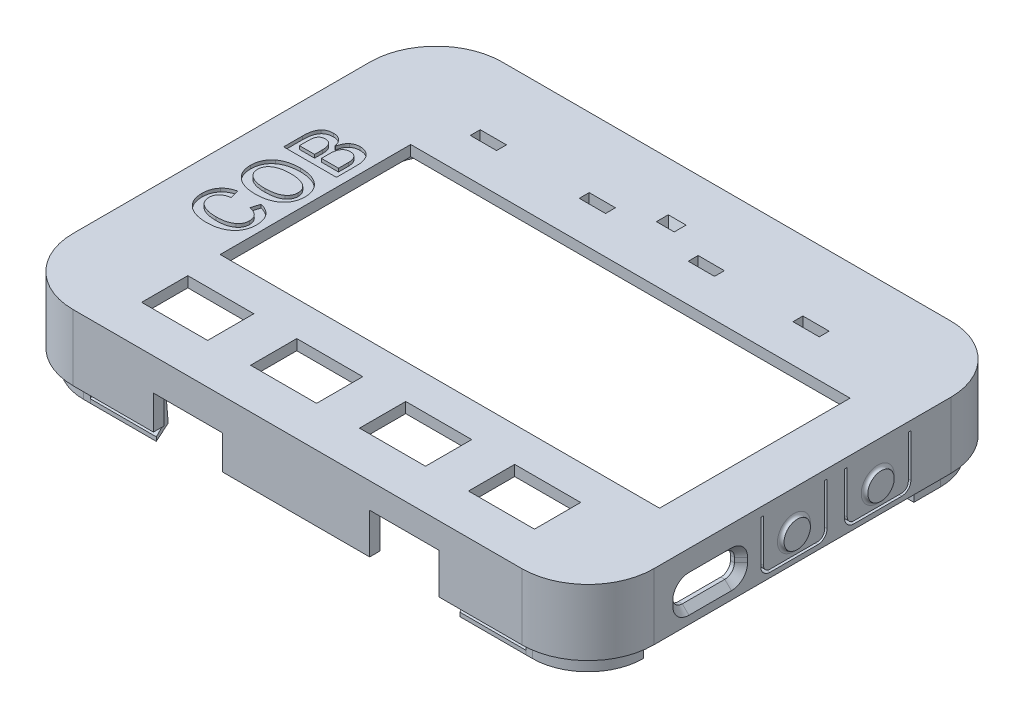
from build123d import *

# Parameters (mm, degrees)
SKETCH1_W              = 88
SKETCH1_H              = 65
BOSS_EXTRUDE1_DEPTH    = 10
FILLET1_R              = 10
SKETCH2_W              = 66.581907709
SKETCH2_H              = 28.876284293
CUT_EXTRUDE1_DEPTH     = 110.859000542
SKETCH4_W              = 10
SKETCH4_H              = 7
CUT_EXTRUDE2_DEPTH     = 110.859000542
CUT_EXTRUDE3_DEPTH     = 8.4
SKETCH11_W             = 10.5
SKETCH11_H             = 5.13
SKETCH11_H_2           = 6.13
CUT_EXTRUDE6_DEPTH     = 5
SKETCH12_W             = 2.7
SKETCH12_H             = 1.8
CUT_EXTRUDE7_DEPTH     = 1.6
CUT_EXTRUDE7_DRAFT     = -20
CUT_EXTRUDE9_DEPTH     = 0.5
SKETCH15_W             = 3.98
SKETCH15_H             = 1.5
CUT_EXTRUDE10_DEPTH    = 110.724928939
SKETCH16_W             = 4.95
SKETCH16_H             = 3.5
SKETCH16_W_2           = 2.95
SKETCH16_H_2           = 1.5
BOSS_EXTRUDE2_DEPTH    = 2.3
CUT_EXTRUDE11_DEPTH    = 10
FILLET2_R              = 0.5
SKETCH19_R             = 2
BOSS_EXTRUDE3_DEPTH    = 0.5
FILLET3_R              = 0.5
CUT_EXTRUDE12_DEPTH    = 5
CHAMFER1_SIZE          = 1
BOSS_EXTRUDE4_START    = 11
BOSS_EXTRUDE4_DEPTH    = 11
BOSS_EXTRUDE10_DEPTH   = 10
BOSS_EXTRUDE10_2_DEPTH = 10
BOSS_EXTRUDE13_DEPTH   = 10
BOSS_EXTRUDE13_2_DEPTH = 10


with BuildPart() as part:
    # Sketch1 → Boss-Extrude1 (new body)
    with BuildSketch(Plane(origin=(0, 0, 0), x_dir=(1, 0, 0), z_dir=(0, 1, 0))):
        with Locations((44, 32.5)):
            Rectangle(SKETCH1_W, SKETCH1_H)
    extrude(amount=BOSS_EXTRUDE1_DEPTH)

    # Fillet1
    fillet1_edges = [part.edges().sort_by_distance(p)[0] for p in [
        (0, 5, -65),
        (88, 5, -65),
        (88, 5, 0),
        (0, 5, 0),
    ]]
    fillet(fillet1_edges, radius=FILLET1_R)

    # Sketch2 → Cut-Extrude1 (cut, through all)
    with BuildSketch(Plane(origin=(0, 10, 0), x_dir=(1, 0, 0), z_dir=(0, 1, 0))):
        with Locations((47.199609362, 32.804029095)):
            Rectangle(SKETCH2_W, SKETCH2_H)
    extrude(amount=-CUT_EXTRUDE1_DEPTH, mode=Mode.SUBTRACT)

    # Sketch4 → Cut-Extrude2 (cut, through all)
    with BuildSketch(Plane(origin=(0, 10, 0), x_dir=(1, 0, 0), z_dir=(0, 1, 0))):
        with Locations((19.235, 9.64)):
            Rectangle(SKETCH4_W, SKETCH4_H)
        with Locations((35.745, 9.64)):
            Rectangle(SKETCH4_W, SKETCH4_H)
        with Locations((52.255, 9.64)):
            Rectangle(SKETCH4_W, SKETCH4_H)
        with Locations((68.765, 9.64)):
            Rectangle(SKETCH4_W, SKETCH4_H)
    extrude(amount=-CUT_EXTRUDE2_DEPTH, mode=Mode.SUBTRACT)

    # Sketch7 → Cut-Extrude3 (cut)
    with BuildSketch(Plane(origin=(0, 0, 0), x_dir=(1, 0, 0), z_dir=(0, 1, 0))):
        with BuildLine():
            Line((86.4, 10), (86.4, 55))
            ThreePointArc((86.4, 55), (83.939696962, 60.939696962), (78, 63.4))
            Line((78, 63.4), (10, 63.4))
            ThreePointArc((10, 63.4), (4.060303038, 60.939696962), (1.6, 55))
            Line((1.6, 55), (1.6, 10))
            ThreePointArc((1.6, 10), (4.060303038, 4.060303038), (10, 1.6))
            Line((10, 1.6), (78, 1.6))
            ThreePointArc((78, 1.6), (83.939696962, 4.060303038), (86.4, 10))
        make_face()
    extrude(amount=CUT_EXTRUDE3_DEPTH, mode=Mode.SUBTRACT)

    # Sketch11 → Cut-Extrude6 (cut)
    with BuildSketch(Plane.XY):
        with Locations((27.417, 2.565)):
            Rectangle(SKETCH11_W, SKETCH11_H)
        with Locations((60.183, 3.065)):
            Rectangle(SKETCH11_W, SKETCH11_H_2)
    extrude(amount=-CUT_EXTRUDE6_DEPTH, mode=Mode.SUBTRACT)


with BuildPart() as cut_extrude7_tool:
    # Sketch12 → Cut-Extrude7 (with draft: the straight prism first)
    with BuildSketch(Plane(origin=(0, 10, 0), x_dir=(1, 0, 0), z_dir=(0, 1, 0))):
        with Locations((44, 56.63)):
            Rectangle(SKETCH12_W, SKETCH12_H)
    extrude(amount=-CUT_EXTRUDE7_DEPTH)
    # Cut-Extrude7: the draft: its side faces are tilted about the plane it starts from
    cut_extrude7_sides = [cut_extrude7_tool.faces().sort_by_distance(p)[0] for p in [
        (42.65, 9.2, -56.63),
        (44, 9.2, -55.73),
        (45.35, 9.2, -56.63),
        (44, 9.2, -57.53),
    ]]
    draft(cut_extrude7_sides, Plane(origin=(0, 10, 0), x_dir=(1, 0, 0), z_dir=(0, 1, 0)), CUT_EXTRUDE7_DRAFT)


with BuildPart() as part_1:
    add(part.part)

    # Cut-Extrude7: cut by cut_extrude7_tool
    add(cut_extrude7_tool.part, mode=Mode.SUBTRACT)

    # Sketch14 → Cut-Extrude9 (cut)
    # profile 1 of 3: a face of its own
    with BuildSketch(Plane(origin=(0, 10, 10), x_dir=(1, 0, 0), z_dir=(0, 1, 0))):
        with BuildLine():
            Line((6.929995969, 38.027206652), (7.257376921, 36.680480461))
            add(Edge.make_bspline(
                [(7.257376921, 36.680480461), (7.124133199, 36.656544226), (6.930398548, 36.613882236), (6.685208312, 36.534836876), (6.51909945, 36.467654672), (6.366277996, 36.392256333), (6.226293276, 36.308906029), (6.101253356, 36.215562309), (5.986293271, 36.116800382), (5.888626726, 36.005045308), (5.801545342, 35.887628322), (5.727489087, 35.76119761), (5.668549866, 35.625581745), (5.622091371, 35.482039918), (5.577961778, 35.274980578), (5.563658965, 35.1136284), (5.565412636, 35.003397128)],
                knots=[0, 0, 0, 0, 0.154392902, 0.22575276, 0.293491049, 0.358492076, 0.41988716, 0.478932014, 0.536231178, 0.59230882, 0.647735325, 0.702733148, 0.758950354, 0.816003382, 0.874463013, 1, 1, 1, 1], degree=3))
            add(Edge.make_bspline(
                [(5.565412636, 35.003397128), (5.564292592, 34.848212252), (5.590521286, 34.618737132), (5.684074975, 34.331220289), (5.77949699, 34.132631886), (5.905189562, 33.949777162), (6.112387933, 33.718124467), (6.30387448, 33.575183821), (6.441900731, 33.491492366)],
                knots=[0, 0, 0, 0, 0.253779586, 0.374092085, 0.493092959, 0.612791307, 0.735735923, 1, 1, 1, 1], degree=3))
            add(Edge.make_bspline(
                [(6.441900731, 33.491492366), (6.580519015, 33.404728757), (6.807600737, 33.297402419), (7.130823711, 33.186191872), (7.396795772, 33.118561041), (7.680589835, 33.065011102), (8.09456188, 33.012916851), (8.415759559, 32.998000864), (8.635353112, 32.998932842)],
                knots=[0, 0, 0, 0, 0.215207414, 0.329987437, 0.45021777, 0.576682166, 0.710521867, 1, 1, 1, 1], degree=3))
            add(Edge.make_bspline(
                [(8.635353112, 32.998932842), (8.883291975, 32.999277231), (9.244851916, 33.016716095), (9.708475283, 33.083008898), (10.021842167, 33.151921206), (10.310471011, 33.243803228), (10.658892811, 33.38408817), (10.895748177, 33.526859533), (11.037138826, 33.6373257)],
                knots=[0, 0, 0, 0, 0.294119863, 0.428492395, 0.555098193, 0.674182319, 0.787369707, 1, 1, 1, 1], degree=3))
            add(Edge.make_bspline(
                [(11.037138826, 33.6373257), (11.14394059, 33.721789418), (11.291971007, 33.860179724), (11.45050582, 34.073478275), (11.546681996, 34.240569037), (11.619247034, 34.418144309), (11.693697292, 34.669741805), (11.710554614, 34.869318986), (11.711245969, 35.003397128)],
                knots=[0, 0, 0, 0, 0.258656829, 0.38178593, 0.503215667, 0.623490563, 0.745037003, 1, 1, 1, 1], degree=3))
            add(Edge.make_bspline(
                [(11.711245969, 35.003397128), (11.713187111, 35.117100777), (11.698526613, 35.283815925), (11.654521686, 35.498311346), (11.608466213, 35.647446308), (11.548844327, 35.788192447), (11.475114147, 35.920119782), (11.389136157, 36.043490914), (11.289425262, 36.158274071), (11.176235736, 36.263390727), (11.049996507, 36.360627124), (10.911102435, 36.450628611), (10.757644403, 36.530034159), (10.591654508, 36.601889948), (10.346598682, 36.686923734), (10.152716828, 36.734115447), (10.019281683, 36.760837604)],
                knots=[0, 0, 0, 0, 0.126813988, 0.186236303, 0.244226671, 0.300811213, 0.356601269, 0.412687499, 0.468441799, 0.526049983, 0.584880758, 0.646183668, 0.710600507, 0.777585684, 0.848007171, 1, 1, 1, 1], degree=3))
            Line((10.019281683, 36.760837604), (10.418091207, 38.071849509))
            add(Edge.make_bspline(
                [(10.418091207, 38.071849509), (10.606257939, 38.023450291), (10.878970738, 37.935509214), (11.220175179, 37.78215632), (11.451477778, 37.653949686), (11.664489859, 37.511563602), (11.860161135, 37.355766114), (12.036189189, 37.183914481), (12.193737453, 36.998111859), (12.332523132, 36.797656789), (12.453832265, 36.582759519), (12.554355416, 36.352450143), (12.63858175, 36.108874211), (12.701830102, 35.850175478), (12.764393122, 35.478184173), (12.781982276, 35.189424924), (12.781186445, 34.992980461)],
                knots=[0, 0, 0, 0, 0.137528344, 0.202266086, 0.264500138, 0.324483071, 0.38342642, 0.441275306, 0.49832171, 0.555588088, 0.613594438, 0.672698592, 0.733209388, 0.795795988, 0.860960733, 1, 1, 1, 1], degree=3))
            add(Edge.make_bspline(
                [(12.781186445, 34.992980461), (12.78208642, 34.85584018), (12.771858603, 34.652776651), (12.739795516, 34.387134083), (12.707428936, 34.196225803), (12.664468902, 34.01125725), (12.60999722, 33.832978722), (12.549860396, 33.659390886), (12.477696688, 33.492107517), (12.396336491, 33.33052563), (12.304820839, 33.174482195), (12.203929717, 33.025277343), (12.094552569, 32.880415271), (11.974441668, 32.743451809), (11.800724169, 32.5655599), (11.658564137, 32.442956949), (11.557972159, 32.366492366)],
                knots=[0, 0, 0, 0, 0.13663975, 0.202372418, 0.266577874, 0.329532173, 0.391466957, 0.452288865, 0.51252736, 0.572883394, 0.632487685, 0.692679506, 0.752300196, 0.813268588, 0.874096523, 1, 1, 1, 1], degree=3))
            add(Edge.make_bspline(
                [(11.557972159, 32.366492366), (11.373423977, 32.22540089), (11.072976705, 32.03892083), (10.636445838, 31.847692691), (10.282360448, 31.731002097), (9.906313498, 31.638528304), (9.361609062, 31.549821237), (8.938495366, 31.528101316), (8.650234064, 31.527206652)],
                knots=[0, 0, 0, 0, 0.226056946, 0.34261086, 0.463254933, 0.588580954, 0.719260793, 1, 1, 1, 1], degree=3))
            add(Edge.make_bspline(
                [(8.650234064, 31.527206652), (8.481076226, 31.528905122), (8.23082795, 31.533007783), (7.903276196, 31.564567683), (7.668990526, 31.593971542), (7.441293495, 31.630515348), (7.222082032, 31.678531222), (7.010151072, 31.733743954), (6.805014599, 31.795683218), (6.608256253, 31.868899753), (6.418155069, 31.949010116), (6.236783504, 32.038797665), (6.061921316, 32.135248607), (5.895083952, 32.241260997), (5.682708868, 32.393260868), (5.536437517, 32.523196945), (5.441900731, 32.61202808)],
                knots=[0, 0, 0, 0, 0.146172457, 0.215867911, 0.284093069, 0.350082654, 0.4149489, 0.477810865, 0.539195812, 0.599914957, 0.659033833, 0.717275481, 0.774612085, 0.831419741, 0.887892054, 1, 1, 1, 1], degree=3))
            add(Edge.make_bspline(
                [(5.441900731, 32.61202808), (5.286490115, 32.761129563), (5.080643771, 33.009607293), (4.858980345, 33.375437534), (4.726522941, 33.667092256), (4.621334214, 33.974314361), (4.523813809, 34.415962156), (4.494604834, 34.759632315), (4.495472159, 34.992980461)],
                knots=[0, 0, 0, 0, 0.244881005, 0.365457154, 0.485990977, 0.608855685, 0.734484742, 1, 1, 1, 1], degree=3))
            add(Edge.make_bspline(
                [(4.495472159, 34.992980461), (4.495358606, 35.199651442), (4.517635705, 35.503779469), (4.592212829, 35.895862562), (4.675805111, 36.167522543), (4.777621339, 36.425526213), (4.947714142, 36.747971415), (5.10834793, 36.969056451), (5.230591207, 37.103099509)],
                knots=[0, 0, 0, 0, 0.270977789, 0.398969378, 0.522681817, 0.643267845, 0.762306112, 1, 1, 1, 1], degree=3))
            add(Edge.make_bspline(
                [(5.230591207, 37.103099509), (5.335138719, 37.218563424), (5.508070827, 37.377122045), (5.763152289, 37.561101138), (5.969741104, 37.683608118), (6.189802252, 37.793255786), (6.50714254, 37.919817842), (6.75827812, 37.989084322), (6.929995969, 38.027206652)],
                knots=[0, 0, 0, 0, 0.237468485, 0.356770322, 0.479298202, 0.603516073, 0.731548816, 1, 1, 1, 1], degree=3))
        make_face()
    # profile 2 of 3: a face of its own
    with BuildSketch(Plane(origin=(0, 10, 10), x_dir=(1, 0, 0), z_dir=(0, 1, 0))):
        with BuildLine():
            Line((4.590710255, 47.302504271), (4.590710255, 50.150718557))
            add(Edge.make_bspline(
                [(4.590710255, 50.150718557), (4.590667839, 50.389107347), (4.604792183, 50.734592159), (4.6704963, 51.173092004), (4.734833263, 51.46220697), (4.819765978, 51.723702016), (4.951493528, 52.029047863), (5.086876659, 52.23056999), (5.191900731, 52.345659033)],
                knots=[0, 0, 0, 0, 0.307780048, 0.445012407, 0.571715917, 0.68952044, 0.799288563, 1, 1, 1, 1], degree=3))
            add(Edge.make_bspline(
                [(5.191900731, 52.345659033), (5.272450203, 52.43307978), (5.407648952, 52.553675727), (5.617752852, 52.673365595), (5.787656018, 52.750369433), (5.972280808, 52.807593249), (6.243362834, 52.865534355), (6.457059879, 52.876156912), (6.602615017, 52.878397128)],
                knots=[0, 0, 0, 0, 0.229834846, 0.346112736, 0.465698798, 0.589255739, 0.718464258, 1, 1, 1, 1], degree=3))
            add(Edge.make_bspline(
                [(6.602615017, 52.878397128), (6.721567779, 52.877899333), (6.898254386, 52.865679592), (7.124229716, 52.812956071), (7.282905196, 52.759469033), (7.43281542, 52.690254389), (7.624184956, 52.577957584), (7.752854022, 52.46995479), (7.831781683, 52.39030189)],
                knots=[0, 0, 0, 0, 0.262795299, 0.388662755, 0.511211232, 0.631708544, 0.752429418, 1, 1, 1, 1], degree=3))
            add(Edge.make_bspline(
                [(7.831781683, 52.39030189), (7.901647521, 52.32141322), (7.995593574, 52.206818641), (8.105084824, 52.0411633), (8.176348194, 51.906934491), (8.237083258, 51.764102137), (8.310444879, 51.561027257), (8.346463793, 51.399992233), (8.366007874, 51.290599509)],
                knots=[0, 0, 0, 0, 0.236568645, 0.356838553, 0.479020022, 0.602962105, 0.731401259, 1, 1, 1, 1], degree=3))
            Line((8.366007874, 51.290599509), (8.43594835, 51.290599509))
            add(Edge.make_bspline(
                [(8.43594835, 51.290599509), (8.459407696, 51.440679647), (8.509820905, 51.657690862), (8.604446593, 51.931925185), (8.68864819, 52.117136524), (8.782986254, 52.288679847), (8.926375033, 52.495658282), (9.05424581, 52.632224762), (9.148745969, 52.711730461)],
                knots=[0, 0, 0, 0, 0.280582372, 0.410755324, 0.53547883, 0.656123495, 0.7720764, 1, 1, 1, 1], degree=3))
            add(Edge.make_bspline(
                [(9.148745969, 52.711730461), (9.227151657, 52.781121019), (9.357085004, 52.869187475), (9.542323559, 52.965820386), (9.688950176, 53.024028294), (9.842669565, 53.068032627), (10.060127472, 53.113446626), (10.229286633, 53.124045414), (10.343686445, 53.123932842)],
                knots=[0, 0, 0, 0, 0.24258732, 0.363154017, 0.484663683, 0.608252624, 0.734097529, 1, 1, 1, 1], degree=3))
            add(Edge.make_bspline(
                [(10.343686445, 53.123932842), (10.521773008, 53.123566372), (10.783675945, 53.100331403), (11.115349226, 53.013497749), (11.341790203, 52.922698226), (11.549699354, 52.803930598), (11.808230197, 52.610742031), (11.972689609, 52.429338822), (12.066900731, 52.295063795)],
                knots=[0, 0, 0, 0, 0.26830114, 0.393508598, 0.515164805, 0.634598964, 0.753076133, 1, 1, 1, 1], degree=3))
            add(Edge.make_bspline(
                [(12.066900731, 52.295063795), (12.158812986, 52.170394586), (12.270778483, 51.962679664), (12.392170969, 51.66657425), (12.463046529, 51.423191716), (12.52242492, 51.165086551), (12.575201259, 50.788393067), (12.592785995, 50.496495282), (12.590710255, 50.29655189)],
                knots=[0, 0, 0, 0, 0.220685554, 0.336150727, 0.456827065, 0.582562648, 0.714416179, 1, 1, 1, 1], degree=3))
            Line((12.590710255, 50.29655189), (12.590710255, 47.302504271))
            Line((12.590710255, 47.302504271), (4.590710255, 47.302504271))
        make_face()
        with BuildLine():
            Line((5.629400731, 48.659647128), (7.924043588, 48.659647128))
            Line((7.924043588, 48.659647128), (7.924043588, 49.873932842))
            add(Edge.make_bspline(
                [(7.924043588, 49.873932842), (7.92298819, 50.007516466), (7.915102024, 50.202346717), (7.876372489, 50.451162276), (7.837021175, 50.61825058), (7.783940955, 50.771195104), (7.703899465, 50.955086142), (7.620300306, 51.077107839), (7.559460255, 51.150718557)],
                knots=[0, 0, 0, 0, 0.295930264, 0.430413945, 0.556910749, 0.675314699, 0.788358809, 1, 1, 1, 1], degree=3))
            add(Edge.make_bspline(
                [(7.559460255, 51.150718557), (7.510342359, 51.207729256), (7.427441799, 51.284996615), (7.302153054, 51.36646161), (7.201940429, 51.416689594), (7.095063491, 51.45518769), (6.939436594, 51.491342905), (6.817796881, 51.501421049), (6.735055493, 51.501909033)],
                knots=[0, 0, 0, 0, 0.243792464, 0.364616719, 0.483228779, 0.606277956, 0.731821626, 1, 1, 1, 1], degree=3))
            add(Edge.make_bspline(
                [(6.735055493, 51.501909033), (6.641682038, 51.500820453), (6.504445104, 51.493640821), (6.333479277, 51.449219839), (6.218617526, 51.408636635), (6.115881189, 51.35246405), (5.989939402, 51.264897376), (5.913882026, 51.177632932), (5.870472159, 51.115004271)],
                knots=[0, 0, 0, 0, 0.28452814, 0.41350556, 0.535520671, 0.653469039, 0.768000715, 1, 1, 1, 1], degree=3))
            add(Edge.make_bspline(
                [(5.870472159, 51.115004271), (5.82705081, 51.051547438), (5.774378233, 50.944091625), (5.719917396, 50.787943444), (5.688482128, 50.653006143), (5.661554409, 50.506087459), (5.634707341, 50.285472293), (5.631416419, 50.113034456), (5.629400731, 49.994468557)],
                knots=[0, 0, 0, 0, 0.197991819, 0.307789238, 0.426486604, 0.555398723, 0.693488623, 1, 1, 1, 1], degree=3))
            Line((5.629400731, 49.994468557), (5.629400731, 48.659647128))
        make_face(mode=Mode.SUBTRACT)
        with BuildLine():
            Line((8.964222159, 48.659647128), (11.552019779, 48.659647128))
            Line((11.552019779, 48.659647128), (11.552019779, 50.14030189))
            add(Edge.make_bspline(
                [(11.552019779, 50.14030189), (11.551464076, 50.270437668), (11.543111236, 50.460705126), (11.499933663, 50.702834907), (11.457519004, 50.865448296), (11.401889381, 51.014401799), (11.314270776, 51.193147722), (11.227931341, 51.312683215), (11.160650731, 51.381373319)],
                knots=[0, 0, 0, 0, 0.293147208, 0.426928683, 0.552827272, 0.670796775, 0.784111992, 1, 1, 1, 1], degree=3))
            add(Edge.make_bspline(
                [(11.160650731, 51.381373319), (11.107342448, 51.439374327), (11.013513091, 51.511811874), (10.877221053, 51.592193429), (10.765518925, 51.639869659), (10.646271221, 51.676726476), (10.472641918, 51.713950803), (10.33635425, 51.720188089), (10.243984064, 51.722147128)],
                knots=[0, 0, 0, 0, 0.233897173, 0.351917903, 0.471221153, 0.595248873, 0.72381907, 1, 1, 1, 1], degree=3))
            add(Edge.make_bspline(
                [(10.243984064, 51.722147128), (10.141798039, 51.724147974), (9.992378527, 51.706692763), (9.802939753, 51.652896919), (9.674787222, 51.594057913), (9.55560502, 51.52035163), (9.406518971, 51.398476759), (9.316729278, 51.281670675), (9.261841207, 51.1998257)],
                knots=[0, 0, 0, 0, 0.262668498, 0.385181214, 0.505840825, 0.624625297, 0.745366069, 1, 1, 1, 1], degree=3))
            add(Edge.make_bspline(
                [(9.261841207, 51.1998257), (9.20998063, 51.121200466), (9.146448048, 50.991851474), (9.077521216, 50.80900224), (9.036191059, 50.65845945), (9.003468525, 50.498916749), (8.974214578, 50.266654465), (8.9626065, 50.087573843), (8.964222159, 49.964706652)],
                knots=[0, 0, 0, 0, 0.218908968, 0.334839246, 0.454862734, 0.582250785, 0.713999908, 1, 1, 1, 1], degree=3))
            Line((8.964222159, 49.964706652), (8.964222159, 48.659647128))
        make_face(mode=Mode.SUBTRACT)
    # profile 3 of 3: a face of its own
    with BuildSketch(Plane(origin=(0, 10, 10), x_dir=(1, 0, 0), z_dir=(0, 1, 0))):
        with BuildLine():
            add(Edge.make_bspline(
                [(4.495472159, 42.381373319), (4.494433315, 42.51703757), (4.504930123, 42.718102863), (4.536742173, 42.980790568), (4.569247311, 43.169725381), (4.612778193, 43.352358161), (4.664291824, 43.530099264), (4.727347265, 43.701220282), (4.798350308, 43.866428085), (4.879408035, 44.025471111), (4.970112994, 44.178395724), (5.07006801, 44.325909645), (5.178710004, 44.468140291), (5.298765609, 44.603135572), (5.469591678, 44.780079644), (5.613883271, 44.897889147), (5.712734064, 44.973635223)],
                knots=[0, 0, 0, 0, 0.136661601, 0.202628603, 0.266562581, 0.329729912, 0.391731518, 0.452927993, 0.513376838, 0.572840135, 0.63267622, 0.692428734, 0.752314905, 0.812879371, 0.874383322, 1, 1, 1, 1], degree=3))
            add(Edge.make_bspline(
                [(5.712734064, 44.973635223), (5.89670803, 45.11450475), (6.19969867, 45.294160693), (6.636486523, 45.482078711), (6.990741617, 45.597399964), (7.36812036, 45.686484694), (7.913751888, 45.773035917), (8.337619456, 45.796043348), (8.62642454, 45.79655189)],
                knots=[0, 0, 0, 0, 0.225291443, 0.341489123, 0.462469922, 0.587599485, 0.718710719, 1, 1, 1, 1], degree=3))
            add(Edge.make_bspline(
                [(8.62642454, 45.79655189), (8.795646209, 45.795579139), (9.04566435, 45.789364042), (9.373466988, 45.761162484), (9.607676257, 45.731242073), (9.834715342, 45.694504956), (10.054154665, 45.648147518), (10.266138218, 45.593372814), (10.470581864, 45.530481645), (10.667950075, 45.461307091), (10.856290955, 45.380659675), (11.037151424, 45.292028415), (11.212215159, 45.197736937), (11.377512962, 45.091553978), (11.590005434, 44.942641169), (11.736963613, 44.815868661), (11.830293588, 44.726611414)],
                knots=[0, 0, 0, 0, 0.146611669, 0.216478235, 0.284908392, 0.35109626, 0.415647479, 0.479114211, 0.540683604, 0.600888527, 0.66018504, 0.718026831, 0.77532828, 0.832306629, 0.888099708, 1, 1, 1, 1], degree=3))
            add(Edge.make_bspline(
                [(11.830293588, 44.726611414), (11.984712402, 44.578881966), (12.195284271, 44.337318403), (12.414316029, 43.973982827), (12.549222461, 43.686971669), (12.653218735, 43.381934575), (12.754480667, 42.944552585), (12.781069221, 42.60260379), (12.781186445, 42.370956652)],
                knots=[0, 0, 0, 0, 0.245327674, 0.365084202, 0.485760771, 0.608502339, 0.734124543, 1, 1, 1, 1], degree=3))
            add(Edge.make_bspline(
                [(12.781186445, 42.370956652), (12.782241569, 42.235287424), (12.771697294, 42.034236642), (12.739960892, 41.771525811), (12.707250986, 41.582653596), (12.664434622, 41.399654328), (12.610332058, 41.223220609), (12.549442474, 41.051893895), (12.478155005, 40.886694774), (12.39580898, 40.727607755), (12.305349043, 40.573402152), (12.203335188, 40.426956911), (12.095101704, 40.283666619), (11.973828097, 40.149717769), (11.801577687, 39.973741884), (11.658092742, 39.855001148), (11.557972159, 39.780182842)],
                knots=[0, 0, 0, 0, 0.136549214, 0.202461966, 0.266343366, 0.32945875, 0.39155214, 0.452058555, 0.512457689, 0.572544209, 0.632331086, 0.692315813, 0.752152734, 0.812998307, 0.874095483, 1, 1, 1, 1], degree=3))
            add(Edge.make_bspline(
                [(11.557972159, 39.780182842), (11.374311064, 39.63947655), (11.071521695, 39.460476065), (10.636776361, 39.269703837), (10.281949852, 39.157159746), (9.906316277, 39.065375568), (9.361326959, 38.979616166), (8.938604273, 38.956011677), (8.650234064, 38.95577808)],
                knots=[0, 0, 0, 0, 0.225246876, 0.341832873, 0.462408049, 0.587862046, 0.718717141, 1, 1, 1, 1], degree=3))
            add(Edge.make_bspline(
                [(8.650234064, 38.95577808), (8.481021495, 38.956806442), (8.230976857, 38.96285961), (7.903216218, 38.991317835), (7.668811876, 39.020554094), (7.441620392, 39.059875615), (7.222163276, 39.105683608), (7.009604087, 39.158469606), (6.805616443, 39.22360357), (6.608257446, 39.294341003), (6.417867002, 39.372938786), (6.236742793, 39.462864326), (6.062422307, 39.559638681), (5.894503409, 39.663498609), (5.684022131, 39.816562416), (5.534472685, 39.941382102), (5.441900731, 40.031670938)],
                knots=[0, 0, 0, 0, 0.146335989, 0.216071181, 0.284372666, 0.350507034, 0.415356571, 0.478182097, 0.539762786, 0.600402935, 0.659421458, 0.717728264, 0.775129014, 0.831771762, 0.888307254, 1, 1, 1, 1], degree=3))
            add(Edge.make_bspline(
                [(5.441900731, 40.031670938), (5.286971533, 40.177849283), (5.079991139, 40.421534106), (4.859459771, 40.782835069), (4.726490344, 41.070244422), (4.621114369, 41.37350594), (4.52398994, 41.810293286), (4.494641599, 42.150484407), (4.495472159, 42.381373319)],
                knots=[0, 0, 0, 0, 0.244893061, 0.365784834, 0.486056558, 0.608618355, 0.73448091, 1, 1, 1, 1], degree=3))
        make_face()
        with BuildLine():
            add(Edge.make_bspline(
                [(5.565412636, 42.381373319), (5.563517107, 42.227888688), (5.591933216, 42.002227064), (5.681823869, 41.718064655), (5.778648575, 41.523674668), (5.903318618, 41.344595392), (6.109244821, 41.118242676), (6.299158985, 40.979942636), (6.43594835, 40.899230461)],
                knots=[0, 0, 0, 0, 0.25441022, 0.374747704, 0.493356157, 0.613532867, 0.735977235, 1, 1, 1, 1], degree=3))
            add(Edge.make_bspline(
                [(6.43594835, 40.899230461), (6.576019025, 40.819180397), (6.800885782, 40.710545351), (7.125628687, 40.608437614), (7.392119712, 40.540429803), (7.677890123, 40.491302544), (8.095061757, 40.439808798), (8.419374113, 40.427814571), (8.641305493, 40.427504271)],
                knots=[0, 0, 0, 0, 0.212358944, 0.326874745, 0.447299391, 0.573878579, 0.707976456, 1, 1, 1, 1], degree=3))
            add(Edge.make_bspline(
                [(8.641305493, 40.427504271), (8.891260127, 40.42584771), (9.254700495, 40.444072758), (9.719980213, 40.509298096), (10.033925979, 40.573349487), (10.322523977, 40.659596912), (10.666975338, 40.795088763), (10.901469407, 40.93053073), (11.041603112, 41.036135223)],
                knots=[0, 0, 0, 0, 0.297823191, 0.432732178, 0.559547231, 0.679225127, 0.791175108, 1, 1, 1, 1], degree=3))
            add(Edge.make_bspline(
                [(11.041603112, 41.036135223), (11.146220136, 41.11892086), (11.29655792, 41.250427933), (11.451209951, 41.460660255), (11.548896913, 41.623474279), (11.621006564, 41.798891864), (11.692730479, 42.049579106), (11.71093068, 42.247665799), (11.711245969, 42.381373319)],
                knots=[0, 0, 0, 0, 0.257168057, 0.379706116, 0.500147884, 0.621014823, 0.742869302, 1, 1, 1, 1], degree=3))
            add(Edge.make_bspline(
                [(11.711245969, 42.381373319), (11.712072661, 42.534041499), (11.686400783, 42.759788778), (11.592531582, 43.041748974), (11.497089998, 43.235932574), (11.371266339, 43.414212865), (11.164334046, 43.640224851), (10.971432053, 43.776123025), (10.834757874, 43.857563795)],
                knots=[0, 0, 0, 0, 0.253760873, 0.373654644, 0.492343995, 0.611925727, 0.735009545, 1, 1, 1, 1], degree=3))
            add(Edge.make_bspline(
                [(10.834757874, 43.857563795), (10.696827076, 43.940446958), (10.470347354, 44.041815364), (10.148196855, 44.145713611), (9.883013023, 44.213185938), (9.598903332, 44.263027878), (9.18383862, 44.310997339), (8.861849454, 44.32527604), (8.641305493, 44.3248257)],
                knots=[0, 0, 0, 0, 0.212480257, 0.327023478, 0.447497066, 0.574150515, 0.7082815, 1, 1, 1, 1], degree=3))
            add(Edge.make_bspline(
                [(8.641305493, 44.3248257), (8.390032557, 44.324800408), (8.024365859, 44.310410947), (7.556677043, 44.244464299), (7.242396943, 44.18050115), (6.953047125, 44.095567193), (6.609618303, 43.960468902), (6.374254274, 43.827726346), (6.235055493, 43.722147128)],
                knots=[0, 0, 0, 0, 0.299063825, 0.434340246, 0.561529063, 0.680280845, 0.792599403, 1, 1, 1, 1], degree=3))
            add(Edge.make_bspline(
                [(6.235055493, 43.722147128), (6.129186338, 43.641041277), (5.981322956, 43.508586837), (5.824533839, 43.300980424), (5.730397546, 43.137221069), (5.654783442, 42.963963294), (5.58449258, 42.712911286), (5.565430747, 42.515215748), (5.565412636, 42.381373319)],
                knots=[0, 0, 0, 0, 0.257160848, 0.37922513, 0.499471023, 0.620118329, 0.742261057, 1, 1, 1, 1], degree=3))
        make_face(mode=Mode.SUBTRACT)
    extrude(amount=-CUT_EXTRUDE9_DEPTH, mode=Mode.SUBTRACT)

    # Sketch15 → Cut-Extrude10 (cut, through all)
    with BuildSketch(Plane(origin=(0, 8.4, 0), x_dir=(-1, 0, 0), z_dir=(0, -1, 0))):
        with Locations((-19.225, 53.7)):
            Rectangle(SKETCH15_W, SKETCH15_H)
        with Locations((-35.735, 53.7)):
            Rectangle(SKETCH15_W, SKETCH15_H)
        with Locations((-52.245, 53.7)):
            Rectangle(SKETCH15_W, SKETCH15_H)
        with Locations((-68.12, 53.7)):
            Rectangle(SKETCH15_W, SKETCH15_H)
    extrude(amount=-CUT_EXTRUDE10_DEPTH, mode=Mode.SUBTRACT)

    # Sketch16 → Boss-Extrude2 (add)
    # profile 1 of 4: a face of its own
    with BuildSketch(Plane.ZY.offset(-86.4)):
        with Locations((-43.923687252, 3.88)):
            Rectangle(SKETCH16_W, SKETCH16_H)
        with Locations((-43.923687252, 3.88)):
            Rectangle(SKETCH16_W_2, SKETCH16_H_2, mode=Mode.SUBTRACT)
    # profile 2 of 4: a face of its own
    with BuildSketch(Plane.ZY.offset(-86.4)):
        with Locations((-43.923687252, 3.88)):
            Rectangle(SKETCH16_W_2, SKETCH16_H_2)
    # profile 3 of 4: a face of its own
    with BuildSketch(Plane.ZY.offset(-86.4)):
        with Locations((-31.223687252, 3.88)):
            Rectangle(SKETCH16_W, SKETCH16_H)
        with Locations((-31.223687252, 3.88)):
            Rectangle(SKETCH16_W_2, SKETCH16_H_2, mode=Mode.SUBTRACT)
    # profile 4 of 4: a face of its own
    with BuildSketch(Plane.ZY.offset(-86.4)):
        with Locations((-31.223687252, 3.88)):
            Rectangle(SKETCH16_W_2, SKETCH16_H_2)
    extrude(amount=BOSS_EXTRUDE2_DEPTH)

    # Sketch18 → Cut-Extrude11 (cut)
    with BuildSketch(Plane(origin=(88, 0, 0), x_dir=(0, 0, -1), z_dir=(1, 0, 0))):
        with BuildLine():
            Line((26.598687252, 8.63), (26.598687252, 2.13))
            ThreePointArc((26.598687252, 2.13), (26.89158047, 1.422893219), (27.598687252, 1.13))
            Line((27.598687252, 1.13), (34.848687252, 1.13))
            ThreePointArc((34.848687252, 1.13), (35.555794033, 1.422893219), (35.848687252, 2.13))
            Line((35.848687252, 2.13), (35.848687252, 8.63))
            Line((35.848687252, 8.63), (36.248687252, 8.63))
            Line((36.248687252, 8.63), (36.248687252, 2.13))
            ThreePointArc((36.248687252, 2.13), (35.838636745, 1.140050506), (34.848687252, 0.73))
            Line((34.848687252, 0.73), (27.598687252, 0.73))
            ThreePointArc((27.598687252, 0.73), (26.608737758, 1.140050506), (26.198687252, 2.13))
            Line((26.198687252, 2.13), (26.198687252, 8.63))
            Line((26.198687252, 8.63), (26.598687252, 8.63))
        make_face()
        with BuildLine():
            Line((39.298687252, 8.63), (39.298687252, 2.13))
            ThreePointArc((39.298687252, 2.13), (39.59158047, 1.422893219), (40.298687252, 1.13))
            Line((40.298687252, 1.13), (47.548687252, 1.13))
            ThreePointArc((47.548687252, 1.13), (48.255794033, 1.422893219), (48.548687252, 2.13))
            Line((48.548687252, 2.13), (48.548687252, 8.63))
            Line((48.548687252, 8.63), (48.948687252, 8.63))
            Line((48.948687252, 8.63), (48.948687252, 2.13))
            ThreePointArc((48.948687252, 2.13), (48.538636745, 1.140050506), (47.548687252, 0.73))
            Line((47.548687252, 0.73), (40.298687252, 0.73))
            ThreePointArc((40.298687252, 0.73), (39.308737758, 1.140050506), (38.898687252, 2.13))
            Line((38.898687252, 2.13), (38.898687252, 8.63))
            Line((38.898687252, 8.63), (39.298687252, 8.63))
        make_face()
    extrude(amount=-CUT_EXTRUDE11_DEPTH, mode=Mode.SUBTRACT)

    # Fillet2
    fillet2_edges = [part_1.edges().sort_by_distance(p)[0] for p in [
        (86.4, 3.88, -46.398687252),
        (86.4, 2.13, -43.923687252),
        (86.4, 3.88, -41.448687252),
        (86.4, 5.63, -43.923687252),
        (86.4, 2.13, -31.223687252),
        (86.4, 3.88, -28.748687252),
        (86.4, 5.63, -31.223687252),
        (86.4, 3.88, -33.698687252),
    ]]
    fillet(fillet2_edges, radius=FILLET2_R)

    # Sketch19 → Boss-Extrude3 (add)
    with BuildSketch(Plane(origin=(88, 0, 0), x_dir=(0, 0, -1), z_dir=(1, 0, 0))):
        with Locations((31.223687252, 4.13)):
            Circle(SKETCH19_R)
        with Locations((43.923687252, 4.13)):
            Circle(SKETCH19_R)
    extrude(amount=BOSS_EXTRUDE3_DEPTH)

    # Fillet3
    fillet3_edges = [part_1.edges().sort_by_distance(p)[0] for p in [
        (88, 4.13, -41.923687252),
        (88, 4.13, -29.223687252),
    ]]
    fillet(fillet3_edges, radius=FILLET3_R - 0.0001)  # a hair under: the kernel refuses the full size

    # Sketch20 → Cut-Extrude12 (cut)
    # profile 1 of 2: a face of its own
    with BuildSketch(Plane(origin=(88, 0, 0), x_dir=(0, 0, -1), z_dir=(1, 0, 0))):
        with BuildLine():
            Line((23.2, 3.68), (23.2, 4.39))
            ThreePointArc((23.2, 4.39), (22.775304833, 5.415304833), (21.75, 5.84))
            Line((21.75, 5.84), (15.31, 5.84))
            ThreePointArc((15.31, 5.84), (14.284695167, 5.415304833), (13.86, 4.39))
            Line((13.86, 4.39), (13.86, 3.68))
            ThreePointArc((13.86, 3.68), (14.284695167, 2.654695167), (15.31, 2.23))
            Line((15.31, 2.23), (21.75, 2.23))
            ThreePointArc((21.75, 2.23), (22.775304833, 2.654695167), (23.2, 3.68))
        make_face()
        with BuildLine():
            ThreePointArc((21.75, 2.43), (22.633883476, 2.796116524), (23, 3.68))
            Line((23, 3.68), (23, 4.39))
            ThreePointArc((23, 4.39), (22.633883476, 5.273883476), (21.75, 5.64))
            Line((21.75, 5.64), (15.31, 5.64))
            ThreePointArc((15.31, 5.64), (14.426116524, 5.273883476), (14.06, 4.39))
            Line((14.06, 4.39), (14.06, 3.68))
            ThreePointArc((14.06, 3.68), (14.426116524, 2.796116524), (15.31, 2.43))
            Line((15.31, 2.43), (21.75, 2.43))
        make_face(mode=Mode.SUBTRACT)
    # profile 2 of 2: a face of its own
    with BuildSketch(Plane(origin=(88, 0, 0), x_dir=(0, 0, -1), z_dir=(1, 0, 0))):
        with BuildLine():
            Line((15.31, 2.43), (21.75, 2.43))
            ThreePointArc((21.75, 2.43), (22.633883476, 2.796116524), (23, 3.68))
            Line((23, 3.68), (23, 4.39))
            ThreePointArc((23, 4.39), (22.633883476, 5.273883476), (21.75, 5.64))
            Line((21.75, 5.64), (15.31, 5.64))
            ThreePointArc((15.31, 5.64), (14.426116524, 5.273883476), (14.06, 4.39))
            Line((14.06, 4.39), (14.06, 3.68))
            ThreePointArc((14.06, 3.68), (14.426116524, 2.796116524), (15.31, 2.43))
        make_face()
    extrude(amount=-CUT_EXTRUDE12_DEPTH, mode=Mode.SUBTRACT)

    # Chamfer1
    chamfer1_edges = [part_1.edges().sort_by_distance(p)[0] for p in [
        (88, 4.035, -23.2),
        (88, 5.415304833, -22.775304833),
        (88, 5.84, -18.53),
        (88, 5.415304833, -14.284695167),
        (88, 4.035, -13.86),
        (88, 2.654695167, -14.284695167),
        (88, 2.23, -18.53),
        (88, 2.654695167, -22.775304833),
    ]]
    chamfer(chamfer1_edges, length=CHAMFER1_SIZE)

    # Sketch21 → Boss-Extrude4 (add)
    with BuildSketch(Plane.XZ.offset(-8.4).offset(BOSS_EXTRUDE4_START)):
        with BuildLine():
            Line((78, -2.6), (77, -2.6))
            Line((77, -2.6), (77, -1.6))
            Line((77, -1.6), (78, -1.6))
            ThreePointArc((78, -1.6), (83.939696962, -4.060303038), (86.4, -10))
            Line((86.4, -10), (85.4, -10))
            ThreePointArc((85.4, -10), (83.232590181, -4.767409819), (78, -2.6))
        make_face()
        with BuildLine():
            Line((10, -2.6), (11, -2.6))
            Line((11, -2.6), (11, -1.6))
            Line((11, -1.6), (10, -1.6))
            ThreePointArc((10, -1.6), (4.060303038, -4.060303038), (1.6, -10))
            Line((1.6, -10), (1.6, -17))
            Line((1.6, -17), (2.6, -17))
            Line((2.6, -17), (2.6, -10))
            ThreePointArc((2.6, -10), (4.767409819, -4.767409819), (10, -2.6))
        make_face()
        with BuildLine():
            Line((2.6, -55), (2.6, -48))
            Line((2.6, -48), (1.6, -48))
            Line((1.6, -48), (1.6, -55))
            ThreePointArc((1.6, -55), (4.060303038, -60.939696962), (10, -63.4))
            Line((10, -63.4), (11, -63.4))
            Line((11, -63.4), (11, -62.4))
            Line((11, -62.4), (10, -62.4))
            ThreePointArc((10, -62.4), (4.767409819, -60.232590181), (2.6, -55))
        make_face()
        with BuildLine():
            Line((85.4, -55), (85.4, -51))
            Line((85.4, -51), (86.4, -51))
            Line((86.4, -51), (86.4, -55))
            ThreePointArc((86.4, -55), (83.939696962, -60.939696962), (78, -63.4))
            Line((78, -63.4), (77, -63.4))
            Line((77, -63.4), (77, -62.4))
            Line((77, -62.4), (78, -62.4))
            ThreePointArc((78, -62.4), (83.232590181, -60.232590181), (85.4, -55))
        make_face()
    extrude(amount=-BOSS_EXTRUDE4_DEPTH)


with BuildPart() as body_2:
    # Sketch24 → Boss-Extrude10 (new body)
    with BuildSketch(Plane.ZY.offset(-77)):
        Polygon((-1.6, -2.6), (-3.404754299, -1.1), (-2.6, 8.4), (-1.6, 8.4), (-1.6, 0), (-2.6, -0.978511569), (-1.6, -2.000471893), align=None)
    extrude(amount=BOSS_EXTRUDE10_DEPTH)


with BuildPart() as body_3:
    # Sketch24 → Boss-Extrude10 2 (new body)
    with BuildSketch(Plane.ZY.offset(-77)):
        Polygon((-62.4, 8.4), (-63.4, 8.4), (-63.4, 0), (-62.4, -0.978511569), (-63.4, -2.000471893), (-63.4, -2.6), (-61.595245701, -1.1), align=None)
    extrude(amount=BOSS_EXTRUDE10_2_DEPTH)


with BuildPart() as body_4:
    # Sketch25 → Boss-Extrude13 (new body)
    with BuildSketch(Plane(origin=(11, 0, -11), x_dir=(0, 0, 1), z_dir=(-1, 0, 0))):
        Polygon((9.4, -2.6), (7.595245701, -1.1), (8.4, 8.4), (9.4, 8.4), (9.4, 0), (8.4, -0.978511569), (9.4, -2.000471893), align=None)
    extrude(amount=-BOSS_EXTRUDE13_DEPTH)


with BuildPart() as body_5:
    # Sketch25 → Boss-Extrude13 2 (new body)
    with BuildSketch(Plane(origin=(11, 0, -11), x_dir=(0, 0, 1), z_dir=(-1, 0, 0))):
        Polygon((-51.4, 8.4), (-52.4, 8.4), (-52.4, 0), (-51.4, -0.978511569), (-52.4, -2.000471893), (-52.4, -2.6), (-50.595245701, -1.1), align=None)
    extrude(amount=-BOSS_EXTRUDE13_2_DEPTH)


solid = Compound([part_1.part, body_2.part, body_3.part, body_4.part, body_5.part])
